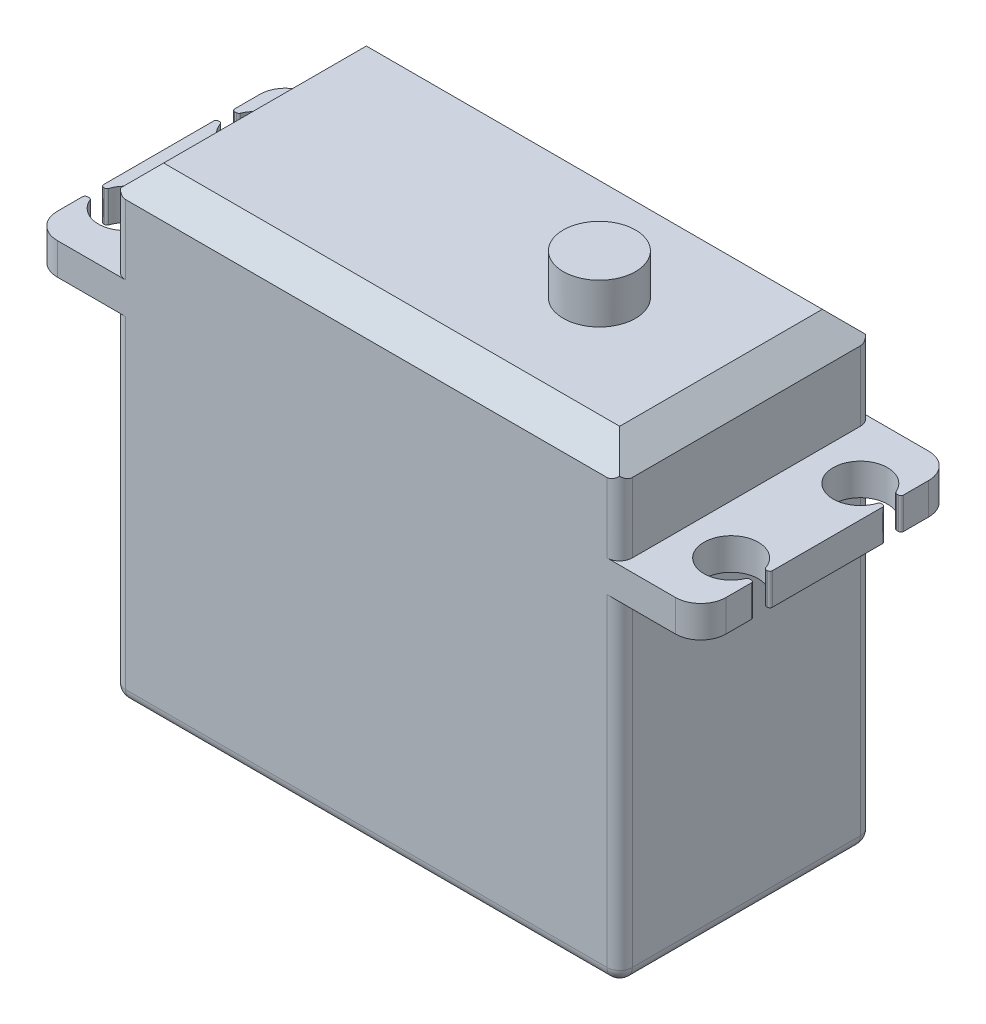
from build123d import *

# Parameters (mm, degrees)
SKETCH_1_W           = 40
SKETCH_1_H           = 20
EXTRUDE_1_DEPTH      = 36.5
SKETCH_2_W           = 52.8
SKETCH_2_H           = 20
EXTRUDE_2_DEPTH      = 2.5
SKETCH_3_R           = 2.15
CUT_EXTRUDE_1_DEPTH  = 4.15
SKETCH_4_W           = 1.589858097
SKETCH_4_H           = 1.269072198
CUT_EXTRUDE_2_DEPTH  = 4.15
FILLET_2_R           = 2
FILLET_3_R           = 1
FILLET_7_R           = 0.2
FILLET_8_R           = 0.2
FILLET_START         = 38.537319575
FILLET_3_2_OUTLINE_W = 42
FILLET_3_2_OUTLINE_H = 6
FILLET_3_2_DEPTH     = 2.462680425
FILLET_START_2       = 24.395183951
FILLET_4_OUTLINE_W   = 42
FILLET_4_OUTLINE_H   = 6
FILLET_4_DEPTH       = 2.604816049
FILLET_START_3       = 52.679455198
FILLET_5_OUTLINE_W   = 5
FILLET_5_OUTLINE_H   = 22
FILLET_5_DEPTH       = 2.320544802
FILLET_START_4       = -27
FILLET_6_OUTLINE_W   = 6
FILLET_6_OUTLINE_H   = 22
FILLET_6_DEPTH       = 2.604816049
SKETCH_5_R           = 2.85
EXTRUDE_3_DEPTH      = 5
CUT_EXTRUDE_START    = -1.8
SKETCH_6_R           = 2.85
CUT_EXTRUDE_3_DEPTH  = 1.8


with BuildPart() as part:
    # 草图1 → 凸台-拉伸1 (new body)
    with BuildSketch(Plane(origin=(0, 0, 0), x_dir=(1, 0, 0), z_dir=(0, 1, 0))):
        with Locations((20, 10)):
            Rectangle(SKETCH_1_W, SKETCH_1_H)
    extrude(amount=EXTRUDE_1_DEPTH)

    # 草图2 → 凸台-拉伸2 (add)
    with BuildSketch(Plane(origin=(0, 26.5, 0), x_dir=(-1, 0, 0), z_dir=(0, -1, 0))):
        with Locations((-20, 10)):
            Rectangle(SKETCH_2_W, SKETCH_2_H)
    extrude(amount=-EXTRUDE_2_DEPTH)

    # 草图3 → 切除-拉伸1 (cut)
    with BuildSketch(Plane(origin=(0, 29, 0), x_dir=(1, 0, 0), z_dir=(0, 1, 0))):
        with Locations(Location((43.9, 15.1, 0), (0, 0, 270))):
            Circle(SKETCH_3_R)
        with Locations(Location((43.9, 4.9, 0), (0, 0, 270))):
            Circle(SKETCH_3_R)
        with Locations(Location((-3.9, 15.1, 0), (0, 0, 270))):
            Circle(SKETCH_3_R)
        with Locations(Location((-3.9, 4.9, 0), (0, 0, 270))):
            Circle(SKETCH_3_R)
    extrude(amount=-CUT_EXTRUDE_1_DEPTH, mode=Mode.SUBTRACT)

    # 草图4 → 切除-拉伸2 (cut)
    with BuildSketch(Plane(origin=(0, 29, 0), x_dir=(1, 0, 0), z_dir=(0, 1, 0))):
        with Locations((-6.117219692, 15.174989867)):
            Rectangle(SKETCH_4_W, SKETCH_4_H)
        with Locations((46.117219692, 15.174989867)):
            Rectangle(SKETCH_4_W, SKETCH_4_H)
        with Locations((46.117219692, 4.825010133)):
            Rectangle(SKETCH_4_W, SKETCH_4_H)
        with Locations((-6.117219692, 4.825010133)):
            Rectangle(SKETCH_4_W, SKETCH_4_H)
    extrude(amount=-CUT_EXTRUDE_2_DEPTH, mode=Mode.SUBTRACT)

    # 圆角2
    fillet_2_edges = [part.edges().sort_by_distance(p)[0] for p in [
        (46.4, 27.75, -20),
        (-6.4, 27.75, 0),
        (46.4, 27.75, 0),
        (-6.4, 27.75, -20),
    ]]
    fillet(fillet_2_edges, radius=FILLET_2_R)

    # Fillet 3
    fillet_3_edges = [part.edges().sort_by_distance(p)[0] for p in [
        (0, 13.25, -20),
        (40, 13.25, -20),
        (40, 13.25, 0),
        (0, 13.25, 0),
        (20, 0, -20),
        (40, 0, -10),
        (20, 0, 0),
        (0, 0, -10),
        (0, 32.75, -20),
        (40, 32.75, -20),
        (40, 32.75, 0),
        (0, 32.75, 0),
    ]]
    fillet(fillet_3_edges, radius=FILLET_3_R)

    # 圆角7
    fillet_7_edges = [part.edges().sort_by_distance(p)[0] for p in [
        (46.4, 27.75, -4.190474034),
        (46.4, 27.75, -5.459546232),
        (45.97591137, 27.75, -5.459546232),
        (45.929549926, 27.75, -4.190474034),
        (45.97591137, 27.75, -14.540453768),
        (45.929549926, 27.75, -15.809525966),
        (-5.97591137, 27.75, -5.459546232),
        (-5.929549926, 27.75, -4.190474034),
        (46.4, 27.75, -15.809525966),
        (46.4, 27.75, -14.540453768),
        (-6.4, 27.75, -4.190474034),
        (-6.4, 27.75, -5.459546232),
    ]]
    fillet(fillet_7_edges, radius=FILLET_7_R)

    # 圆角8
    fillet_8_edges = [part.edges().sort_by_distance(p)[0] for p in [
        (-6.4, 27.75, -14.540453768),
        (-6.4, 27.75, -15.809525966),
        (-5.929549926, 27.75, -15.809525966),
        (-5.97591137, 27.75, -14.540453768),
    ]]
    fillet(fillet_8_edges, radius=FILLET_8_R)

    # Fillet 3 2: read off the stored shape, not the designer's step
    # Fillet 3 2 outline → Fillet 3 2 (cut)
    with BuildSketch(Plane(origin=(0, 0, 0), x_dir=(1, 0, 0), z_dir=(0, 0.707106781186547, -0.707106781186548)).offset(FILLET_START)):
        with Locations((20, -12)):
            Rectangle(FILLET_3_2_OUTLINE_W, FILLET_3_2_OUTLINE_H)
    extrude(amount=FILLET_3_2_DEPTH, mode=Mode.SUBTRACT)

    # 倒角4: read off the stored shape, not the designer's step
    # 倒角4 outline → 倒角4 (cut)
    with BuildSketch(Plane(origin=(0, 0, 0), x_dir=(1, 0, 0), z_dir=(0, 0.707106781186547, 0.707106781186548)).offset(FILLET_START_2)):
        with Locations((20, 26)):
            Rectangle(FILLET_4_OUTLINE_W, FILLET_4_OUTLINE_H)
    extrude(amount=FILLET_4_DEPTH, mode=Mode.SUBTRACT)

    # 倒角5: read off the stored shape, not the designer's step
    # 倒角5 outline → 倒角5 (cut)
    with BuildSketch(Plane(origin=(0, 0, 0), x_dir=(0.707106781186546, -0.707106781186549, 0), z_dir=(0.707106781186549, 0.707106781186546, 0)).offset(FILLET_START_3)):
        with Locations((2.5, 10)):
            Rectangle(FILLET_5_OUTLINE_W, FILLET_5_OUTLINE_H)
    extrude(amount=FILLET_5_DEPTH, mode=Mode.SUBTRACT)

    # 倒角6: read off the stored shape, not the designer's step
    # 倒角6 outline → 倒角6 (cut)
    with BuildSketch(Plane(origin=(0, 0, 0), x_dir=(0.7071067811865471, 0.707106781186548, 0), z_dir=(0.707106781186548, -0.707106781186547, 0)).offset(FILLET_START_4)):
        with Locations((26, -10)):
            Rectangle(FILLET_6_OUTLINE_W, FILLET_6_OUTLINE_H)
    extrude(amount=FILLET_6_DEPTH, mode=Mode.SUBTRACT)

    # 草图5 → 凸台-拉伸3 (add)
    with BuildSketch(Plane(origin=(0, 36.5, 0), x_dir=(1, 0, 0), z_dir=(0, 1, 0))):
        with Locations(Location((28.4, 10, 0), (0, 0, 90))):
            Circle(SKETCH_5_R)
    extrude(amount=EXTRUDE_3_DEPTH)

    # 草图6 → 切除-拉伸3 (cut)
    with BuildSketch(Plane(origin=(0, 41.5, 0), x_dir=(1, 0, 0), z_dir=(0, 1, 0)).offset(CUT_EXTRUDE_START)):
        with Locations(Location((28.4, 10, 0), (0, 0, 90))):
            Circle(SKETCH_6_R)
    extrude(amount=CUT_EXTRUDE_3_DEPTH, mode=Mode.SUBTRACT)


solid = part.part
